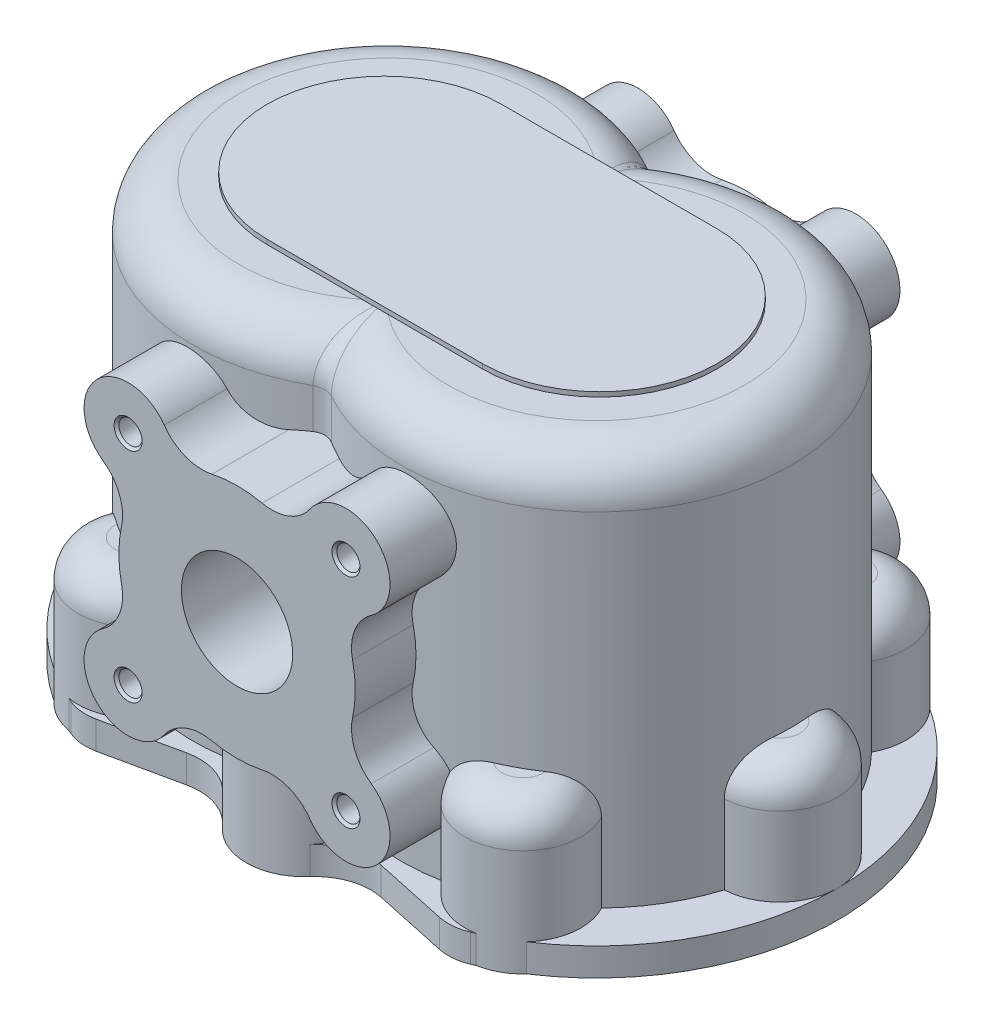
from build123d import *

# Parameters (mm, degrees)
EXTRUDE_1_DEPTH              = 6
EXTRUDE_2_DEPTH              = 90
FILLET_1_R                   = 10
SKETCH_4_R                   = 12.5
EXTRUDE_3_DEPTH              = 31
FILLET_3_R                   = 8
EXTRUDE_5_DEPTH              = 55
EXTRUDE_5_DEPTH_BACK         = 55
CUT_EXTRUDE_1_DEPTH          = 2
CUT_EXTRUDE_2_DEPTH          = 83
SKETCH_7_R                   = 13.5
CUT_EXTRUDE_3_DEPTH          = 4
FILLET_4_R                   = 4
FILLET_5_R                   = 4
EXTRUDE_4_DEPTH              = 1
SKETCH_10_R                  = 12
CUT_EXTRUDE_4_DEPTH          = 162.031829266
HOLE_WIZARD_M61_D            = 5
HOLE_WIZARD_M61_DEPTH        = 20
HOLE_WIZARD_M61_CSINK_D      = 6.05
HOLE_WIZARD_M61_CSINK_ANGLE  = 90
HOLE_WIZARD_M61_TIP          = 2.5
HOLE_WIZARD_M62_D            = 5
HOLE_WIZARD_M62_DEPTH        = 20
HOLE_WIZARD_M62_CSINK_D      = 6.05
HOLE_WIZARD_M62_CSINK_ANGLE  = 90
HOLE_WIZARD_M62_TIP          = 2.5
HOLE_WIZARD_M101_D           = 8.5
HOLE_WIZARD_M101_DEPTH       = 24.5
HOLE_WIZARD_M101_CSINK_D     = 10.05
HOLE_WIZARD_M101_CSINK_ANGLE = 90
HOLE_WIZARD_M101_TIP         = 4.25
SKETCH_17_R                  = 6.5
CUT_EXTRUDE_5_DEPTH          = 6
SKETCH_18_R                  = 6.5
CUT_EXTRUDE_6_DEPTH          = 9


with BuildPart() as part:
    # Эскиз2 → Бобышка-Вытянуть1 (new body)
    with BuildSketch(Plane(origin=(0, 0, 0), x_dir=(1, 0, 0), z_dir=(0, 1, 0))):
        with BuildLine():
            Line((-37.052963336, 48.333209757), (-20.9812026, 44.877765575))
            ThreePointArc((-20.9812026, 44.877765575), (-14.675642031, 45.221631512), (-9.417771013, 48.719220715))
            ThreePointArc((-9.417771013, 48.719220715), (0, 53), (9.417771013, 48.719220715))
            ThreePointArc((9.417771013, 48.719220715), (14.675642031, 45.221631512), (20.9812026, 44.877765575))
            Line((20.9812026, 44.877765575), (37.052963336, 48.333209757))
            ThreePointArc((37.052963336, 48.333209757), (40.133244299, 48.508651505), (43.120401305, 47.736768324))
            ThreePointArc((43.120401305, 47.736768324), (74.5, 0), (43.120401305, -47.736768324))
            ThreePointArc((43.120401305, -47.736768324), (40.133244299, -48.508651505), (37.052963336, -48.333209757))
            Line((37.052963336, -48.333209757), (20.9812026, -44.877765575))
            ThreePointArc((20.9812026, -44.877765575), (14.675642031, -45.221631512), (9.417771013, -48.719220715))
            ThreePointArc((9.417771013, -48.719220715), (0, -53), (-9.417771013, -48.719220715))
            ThreePointArc((-9.417771013, -48.719220715), (-14.675642031, -45.221631512), (-20.9812026, -44.877765575))
            Line((-20.9812026, -44.877765575), (-37.052963336, -48.333209757))
            ThreePointArc((-37.052963336, -48.333209757), (-40.133244299, -48.508651505), (-43.120401305, -47.736768324))
            ThreePointArc((-43.120401305, -47.736768324), (-74.5, 0), (-43.120401305, 47.736768324))
            ThreePointArc((-43.120401305, 47.736768324), (-40.133244299, 48.508651505), (-37.052963336, 48.333209757))
        make_face()
    extrude(amount=EXTRUDE_1_DEPTH)

    # Эскиз3 → Бобышка-Вытянуть2 (add)
    with BuildSketch(Plane(origin=(0, 0, 0), x_dir=(1, 0, 0), z_dir=(0, 1, 0))):
        with BuildLine():
            ThreePointArc((0, 35.464771253), (-64.5, 0), (0, -35.464771253))
            ThreePointArc((0, -35.464771253), (64.5, 0), (0, 35.464771253))
        make_face()
    extrude(amount=EXTRUDE_2_DEPTH)

    # Скругление1
    fillet_1_edges = [part.edges().sort_by_distance(p)[0] for p in [
        (64.5, 90, 0),
        (-64.5, 90, 0),
    ]]
    fillet(fillet_1_edges, radius=FILLET_1_R)

    # Эскиз4 → Бобышка-Вытянуть3 (add)
    with BuildSketch(Plane.XZ):
        with Locations((0, 40.5)):
            Circle(SKETCH_4_R)
        with Locations((0, -40.5)):
            Circle(SKETCH_4_R)
        with Locations((-62, 0)):
            Circle(SKETCH_4_R)
        with Locations((62, 0)):
            Circle(SKETCH_4_R)
        with Locations((-41.75, 35.074028853)):
            Circle(SKETCH_4_R)
        with Locations((-41.75, -35.074028853)):
            Circle(SKETCH_4_R)
        with Locations((41.75, -35.074028853)):
            Circle(SKETCH_4_R)
        with Locations((41.75, 35.074028853)):
            Circle(SKETCH_4_R)
    extrude(amount=-EXTRUDE_3_DEPTH)

    # Скругление3
    fillet_3_edges = [part.edges().sort_by_distance(p)[0] for p in [
        (-47.764215583, 31, 46.032094874),
        (-47.764215583, 31, -46.032094874),
        (47.764215583, 31, -46.032094874),
        (47.764215583, 31, 46.032094874),
        (0, 31, 53),
        (0, 31, -53),
        (-74.5, 31, 0),
        (74.5, 31, 0),
    ]]
    fillet(fillet_3_edges, radius=FILLET_3_R)

    # Эскиз9 → Бобышка-Вытянуть5 (add, two sides: drawn at the far end of the back side and taken through both)
    with BuildSketch(Plane.XY.offset(-EXTRUDE_5_DEPTH_BACK)):
        with BuildLine():
            ThreePointArc((-24.919514206, 51.409973358), (-25.5, 46), (-24.919514206, 40.590026642))
            ThreePointArc((-24.919514206, 40.590026642), (-25.37895052, 34.8257387), (-28.952450812, 30.279510277))
            ThreePointArc((-28.952450812, 30.279510277), (-30.217514421, 15.782485579), (-15.720489723, 17.047549188))
            ThreePointArc((-15.720489723, 17.047549188), (-11.1742613, 20.62104948), (-5.409973358, 21.080485794))
            ThreePointArc((-5.409973358, 21.080485794), (0, 20.5), (5.409973358, 21.080485794))
            ThreePointArc((5.409973358, 21.080485794), (11.1742613, 20.62104948), (15.720489723, 17.047549188))
            ThreePointArc((15.720489723, 17.047549188), (30.217514421, 15.782485579), (28.952450812, 30.279510277))
            ThreePointArc((28.952450812, 30.279510277), (25.37895052, 34.8257387), (24.919514206, 40.590026642))
            ThreePointArc((24.919514206, 40.590026642), (25.5, 46), (24.919514206, 51.409973358))
            ThreePointArc((24.919514206, 51.409973358), (25.37895052, 57.1742613), (28.952450812, 61.720489723))
            ThreePointArc((28.952450812, 61.720489723), (30.217514421, 76.217514421), (15.720489723, 74.952450812))
            ThreePointArc((15.720489723, 74.952450812), (11.1742613, 71.37895052), (5.409973358, 70.919514206))
            ThreePointArc((5.409973358, 70.919514206), (0, 71.5), (-5.409973358, 70.919514206))
            ThreePointArc((-5.409973358, 70.919514206), (-11.1742613, 71.37895052), (-15.720489723, 74.952450812))
            ThreePointArc((-15.720489723, 74.952450812), (-30.217514421, 76.217514421), (-28.952450812, 61.720489723))
            ThreePointArc((-28.952450812, 61.720489723), (-25.37895052, 57.1742613), (-24.919514206, 51.409973358))
        make_face()
    extrude(amount=EXTRUDE_5_DEPTH + EXTRUDE_5_DEPTH_BACK)

    # Эскиз5 → Вырез-Вытянуть1 (cut)
    with BuildSketch(Plane.XZ):
        with BuildLine():
            Line((-22.5, 33), (22.5, 33))
            ThreePointArc((22.5, 33), (55.5, 0), (22.5, -33))
            Line((22.5, -33), (-22.5, -33))
            ThreePointArc((-22.5, -33), (-55.5, 0), (-22.5, 33))
        make_face()
    extrude(amount=-CUT_EXTRUDE_1_DEPTH, mode=Mode.SUBTRACT)

    # Эскиз6 → Вырез-Вытянуть2 (cut)
    with BuildSketch(Plane.XZ.offset(-2)):
        with BuildLine():
            ThreePointArc((0, 15.37245914), (-49.75, 0), (0, -15.37245914))
            ThreePointArc((0, -15.37245914), (49.75, 0), (0, 15.37245914))
        make_face()
    extrude(amount=-CUT_EXTRUDE_2_DEPTH, mode=Mode.SUBTRACT)

    # Эскиз7 → Вырез-Вытянуть3 (cut)
    with BuildSketch(Plane.XZ.offset(-85)):
        with Locations(Location((-22.5, 0, 0), (0, 0, 270))):
            Circle(SKETCH_7_R)
        with Locations(Location((22.5, 0, 0), (0, 0, 270))):
            Circle(SKETCH_7_R)
    extrude(amount=-CUT_EXTRUDE_3_DEPTH, mode=Mode.SUBTRACT)

    # Скругление4
    fillet_4_edges = [part.edges().sort_by_distance(p)[0] for p in [
        (-22.5, 89, 13.5),
        (22.5, 89, 13.5),
    ]]
    fillet(fillet_4_edges, radius=FILLET_4_R - 0.0001)  # a hair under: the kernel refuses the full size

    # Скругление5
    fillet_5_edges = [part.edges().sort_by_distance(p)[0] for p in [
        (0, 75.75, -35.464771253),
        (0, 75.75, 35.464771253),
        (0, 87.573734098, 31.277740399),
        (0, 87.573734098, -31.277740399),
    ]]
    fillet(fillet_5_edges, radius=FILLET_5_R)

    # Эскиз8 → Бобышка-Вытянуть4 (add)
    with BuildSketch(Plane(origin=(0, 90, 0), x_dir=(1, 0, 0), z_dir=(0, 1, 0))):
        with BuildLine():
            Line((-23.25, 25.25), (23.25, 25.25))
            ThreePointArc((23.25, 25.25), (48.5, 0), (23.25, -25.25))
            Line((23.25, -25.25), (-23.25, -25.25))
            ThreePointArc((-23.25, -25.25), (-48.5, 0), (-23.25, 25.25))
        make_face()
    extrude(amount=EXTRUDE_4_DEPTH)

    # Эскиз10 → Вырез-Вытянуть4 (cut, through all)
    with BuildSketch(Plane(origin=(0, 0, -55), x_dir=(-1, 0, 0), z_dir=(0, 0, -1))):
        with Locations((0, 46)):
            Circle(SKETCH_10_R)
    extrude(amount=-CUT_EXTRUDE_4_DEPTH, mode=Mode.SUBTRACT)

    # Отверстие обработанное метчиком M61
    with Locations(Plane.XY.offset(55)):
        with Locations((23.5, 69.5), (-23.5, 69.5), (-23.5, 22.5), (23.5, 22.5)):
            CounterSinkHole(HOLE_WIZARD_M61_D / 2, HOLE_WIZARD_M61_CSINK_D / 2, depth=HOLE_WIZARD_M61_DEPTH, counter_sink_angle=HOLE_WIZARD_M61_CSINK_ANGLE)
            with Locations((0, 0, -(HOLE_WIZARD_M61_DEPTH + HOLE_WIZARD_M61_TIP / 2))):  # 90° drill point
                Cone(0, HOLE_WIZARD_M61_D / 2, HOLE_WIZARD_M61_TIP, mode=Mode.SUBTRACT)

    # Отверстие обработанное метчиком M62
    with Locations(Plane(origin=(0, 0, -55), x_dir=(-1, 0, 0), z_dir=(0, 0, -1))):
        with Locations((-23.5, 69.5), (23.5, 69.5), (23.5, 22.5), (-23.5, 22.5)):
            CounterSinkHole(HOLE_WIZARD_M62_D / 2, HOLE_WIZARD_M62_CSINK_D / 2, depth=HOLE_WIZARD_M62_DEPTH, counter_sink_angle=HOLE_WIZARD_M62_CSINK_ANGLE)
            with Locations((0, 0, -(HOLE_WIZARD_M62_DEPTH + HOLE_WIZARD_M62_TIP / 2))):  # 90° drill point
                Cone(0, HOLE_WIZARD_M62_D / 2, HOLE_WIZARD_M62_TIP, mode=Mode.SUBTRACT)

    # Отверстие обработанное метчиком M101
    with Locations(Plane(origin=(0, 0, 0), x_dir=(-1, 0, 0), z_dir=(0, -1, 0))):
        with Locations((0, 40.5), (0, -40.5), (-63.5, 0), (63.5, 0), (43, -35.507041555), (43, 35.507041555), (-43, 35.507041555), (-43, -35.507041555)):
            CounterSinkHole(HOLE_WIZARD_M101_D / 2, HOLE_WIZARD_M101_CSINK_D / 2, depth=HOLE_WIZARD_M101_DEPTH, counter_sink_angle=HOLE_WIZARD_M101_CSINK_ANGLE)
            with Locations((0, 0, -(HOLE_WIZARD_M101_DEPTH + HOLE_WIZARD_M101_TIP / 2))):  # 90° drill point
                Cone(0, HOLE_WIZARD_M101_D / 2, HOLE_WIZARD_M101_TIP, mode=Mode.SUBTRACT)

    # Эскиз17 → Вырез-Вытянуть5 (cut)
    with BuildSketch(Plane.XZ):
        with Locations(Location((0, 40.5, 0), (0, 0, 270))):
            Circle(SKETCH_17_R)
    extrude(amount=-CUT_EXTRUDE_5_DEPTH, mode=Mode.SUBTRACT)

    # Эскиз18 → Вырез-Вытянуть6 (cut)
    with BuildSketch(Plane.XZ):
        with Locations(Location((0, -40.5, 0), (0, 0, 270))):
            Circle(SKETCH_18_R)
    extrude(amount=-CUT_EXTRUDE_6_DEPTH, mode=Mode.SUBTRACT)


solid = part.part
